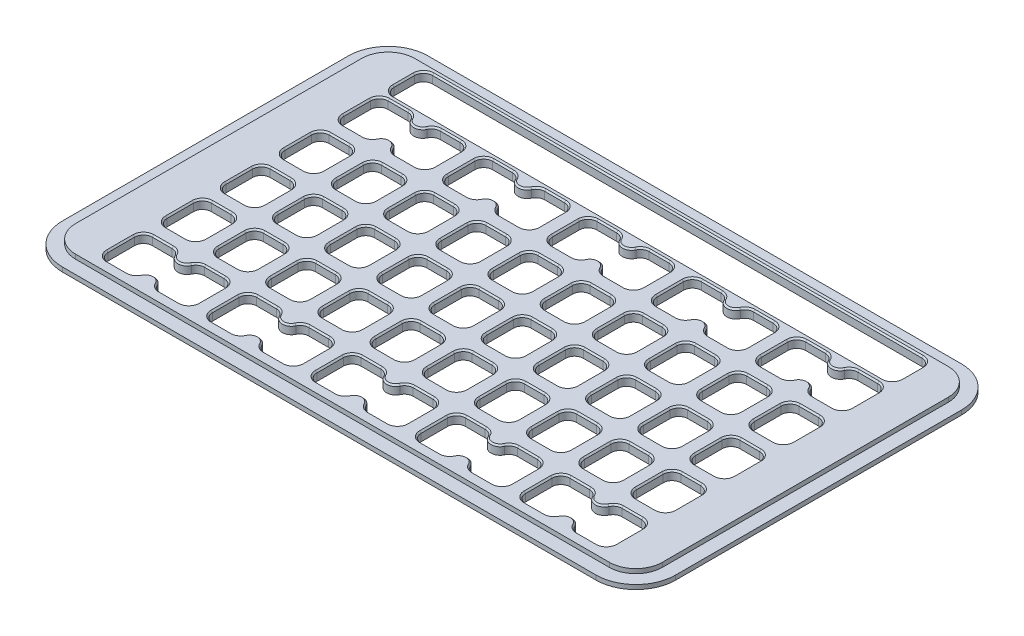
from build123d import *

# Parameters (mm, degrees)
SKETCH1_W                    = 208
SKETCH1_H                    = 124
OUTER_PROFILE_DEPTH          = 1.5
SKETCH2_W                    = 199
SKETCH2_H                    = 115
INNER_PROFILE_DEPTH          = 1.5
FILLET1_R                    = 9
FILLET2_R                    = 13.5
SKETCH4_W                    = 172
SKETCH4_H                    = 13
MESSAGE_BAR_DEPTH            = 122.115647214
CUTOUT_DEPTH                 = 122.115647214
CUTOUTS_COUNT                = 5
CUTOUTS_PITCH                = 17.7
CUTOUTS_COUNT_DIR2           = 5
CUTOUTS_PITCH_DIR2           = 20
MIRROR_CUTOUTS_COPY_1_DEPTH  = 122.115647214
MIRROR_CUTOUTS_COPY_2_DEPTH  = 122.115647214
MIRROR_CUTOUTS_COPY_3_DEPTH  = 122.115647214
MIRROR_CUTOUTS_COPY_4_DEPTH  = 122.115647214
MIRROR_CUTOUTS_COPY_5_DEPTH  = 122.115647214
MIRROR_CUTOUTS_COPY_6_DEPTH  = 122.115647214
MIRROR_CUTOUTS_COPY_7_DEPTH  = 122.115647214
MIRROR_CUTOUTS_COPY_8_DEPTH  = 122.115647214
MIRROR_CUTOUTS_COPY_9_DEPTH  = 122.115647214
MIRROR_CUTOUTS_COPY_10_DEPTH = 122.115647214
MIRROR_CUTOUTS_COPY_11_DEPTH = 122.115647214
MIRROR_CUTOUTS_COPY_12_DEPTH = 122.115647214
MIRROR_CUTOUTS_COPY_13_DEPTH = 122.115647214
MIRROR_CUTOUTS_COPY_14_DEPTH = 122.115647214
MIRROR_CUTOUTS_COPY_15_DEPTH = 122.115647214
MIRROR_CUTOUTS_COPY_16_DEPTH = 122.115647214
MIRROR_CUTOUTS_COPY_17_DEPTH = 122.115647214
MIRROR_CUTOUTS_COPY_18_DEPTH = 122.115647214
MIRROR_CUTOUTS_COPY_19_DEPTH = 122.115647214
MIRROR_CUTOUTS_COPY_20_DEPTH = 122.115647214
MIRROR_CUTOUTS_COPY_21_DEPTH = 122.115647214
MIRROR_CUTOUTS_COPY_22_DEPTH = 122.115647214
MIRROR_CUTOUTS_COPY_23_DEPTH = 122.115647214
MIRROR_CUTOUTS_COPY_24_DEPTH = 122.115647214
CORNER_RAD_R                 = 3
OPENING_DEPTH                = 122.115647214
OPENINGS_COUNT               = 5
OPENINGS_PITCH               = 35.4
OPENINGS_COUNT_DIR2          = 2
OPENINGS_PITCH_DIR2          = 80
CHAMFER_2_SIZE               = 0.5


with BuildPart() as part:
    # Sketch1 → Outer Profile (new body)
    with BuildSketch(Plane(origin=(0, 0, 0), x_dir=(1, 0, 0), z_dir=(0, 1, 0))):
        Rectangle(SKETCH1_W, SKETCH1_H)
    extrude(amount=OUTER_PROFILE_DEPTH)

    # Sketch2 → Inner Profile (add)
    with BuildSketch(Plane(origin=(0, 1.5, 0), x_dir=(1, 0, 0), z_dir=(0, 1, 0))):
        Rectangle(SKETCH2_W, SKETCH2_H)
    extrude(amount=INNER_PROFILE_DEPTH)

    # Fillet1
    fillet1_edges = [part.edges().sort_by_distance(p)[0] for p in [
        (99.5, 2.25, 57.5),
        (99.5, 2.25, -57.5),
        (-99.5, 2.25, -57.5),
        (-99.5, 2.25, 57.5),
    ]]
    fillet(fillet1_edges, radius=FILLET1_R)

    # Fillet2
    fillet2_edges = [part.edges().sort_by_distance(p)[0] for p in [
        (104, 0.75, 62),
        (-104, 0.75, 62),
        (-104, 0.75, -62),
        (104, 0.75, -62),
    ]]
    fillet(fillet2_edges, radius=FILLET2_R)

    # Sketch4 → Message Bar (cut, through all)
    with BuildSketch(Plane(origin=(0, 3, 0), x_dir=(1, 0, 0), z_dir=(0, 1, 0))):
        with Locations((0, 49.5)):
            Rectangle(SKETCH4_W, SKETCH4_H)
    extrude(amount=-MESSAGE_BAR_DEPTH, mode=Mode.SUBTRACT)

    # Sketch5 → Cutout (cut, through all)
    with BuildSketch(Plane(origin=(0, 3, 0), x_dir=(1, 0, 0), z_dir=(0, 1, 0))):
        with BuildLine():
            Line((-12.2, -54), (-5.5, -54))
            ThreePointArc((-5.5, -54), (-3.378679656, -53.121320344), (-2.5, -51))
            Line((-2.5, -51), (-2.5, -42))
            ThreePointArc((-2.5, -42), (-3.378679656, -39.878679656), (-5.5, -39))
            Line((-5.5, -39), (-12.2, -39))
            ThreePointArc((-12.2, -39), (-14.321320344, -39.878679656), (-15.2, -42))
            Line((-15.2, -42), (-15.2, -51))
            ThreePointArc((-15.2, -51), (-14.321320344, -53.121320344), (-12.2, -54))
        make_face()
    cutout = extrude(amount=-CUTOUT_DEPTH, mode=Mode.SUBTRACT)

    # Cutouts: Cutout 5 × 5
    with Locations(*[(-i * CUTOUTS_PITCH, 0, -j * CUTOUTS_PITCH_DIR2) for i in range(CUTOUTS_COUNT) for j in range(CUTOUTS_COUNT_DIR2) if (i, j) != (0, 0)]):
        add(cutout, mode=Mode.SUBTRACT)

    # Mirror Cutouts: Cutout across plane
    add(cutout.mirror(Plane(origin=(0, 0, 0), x_dir=(0, 0, 1), z_dir=(1, 0, 0))), mode=Mode.SUBTRACT)

    # Mirror Cutouts copy 1 sketch → Mirror Cutouts copy 1 (cut, through all)
    with BuildSketch(Plane(origin=(0, 3, -20), x_dir=(-1, 0, 0), z_dir=(0, 1, 0))):
        with BuildLine():
            Line((-12.2, 54), (-5.5, 54))
            ThreePointArc((-5.5, 54), (-3.378679656, 53.121320344), (-2.5, 51))
            Line((-2.5, 51), (-2.5, 42))
            ThreePointArc((-2.5, 42), (-3.378679656, 39.878679656), (-5.5, 39))
            Line((-5.5, 39), (-12.2, 39))
            ThreePointArc((-12.2, 39), (-14.321320344, 39.878679656), (-15.2, 42))
            Line((-15.2, 42), (-15.2, 51))
            ThreePointArc((-15.2, 51), (-14.321320344, 53.121320344), (-12.2, 54))
        make_face()
    extrude(amount=-MIRROR_CUTOUTS_COPY_1_DEPTH, mode=Mode.SUBTRACT)

    # Mirror Cutouts copy 2 sketch → Mirror Cutouts copy 2 (cut, through all)
    with BuildSketch(Plane(origin=(0, 3, -40), x_dir=(-1, 0, 0), z_dir=(0, 1, 0))):
        with BuildLine():
            Line((-12.2, 54), (-5.5, 54))
            ThreePointArc((-5.5, 54), (-3.378679656, 53.121320344), (-2.5, 51))
            Line((-2.5, 51), (-2.5, 42))
            ThreePointArc((-2.5, 42), (-3.378679656, 39.878679656), (-5.5, 39))
            Line((-5.5, 39), (-12.2, 39))
            ThreePointArc((-12.2, 39), (-14.321320344, 39.878679656), (-15.2, 42))
            Line((-15.2, 42), (-15.2, 51))
            ThreePointArc((-15.2, 51), (-14.321320344, 53.121320344), (-12.2, 54))
        make_face()
    extrude(amount=-MIRROR_CUTOUTS_COPY_2_DEPTH, mode=Mode.SUBTRACT)

    # Mirror Cutouts copy 3 sketch → Mirror Cutouts copy 3 (cut, through all)
    with BuildSketch(Plane(origin=(0, 3, -60), x_dir=(-1, 0, 0), z_dir=(0, 1, 0))):
        with BuildLine():
            Line((-12.2, 54), (-5.5, 54))
            ThreePointArc((-5.5, 54), (-3.378679656, 53.121320344), (-2.5, 51))
            Line((-2.5, 51), (-2.5, 42))
            ThreePointArc((-2.5, 42), (-3.378679656, 39.878679656), (-5.5, 39))
            Line((-5.5, 39), (-12.2, 39))
            ThreePointArc((-12.2, 39), (-14.321320344, 39.878679656), (-15.2, 42))
            Line((-15.2, 42), (-15.2, 51))
            ThreePointArc((-15.2, 51), (-14.321320344, 53.121320344), (-12.2, 54))
        make_face()
    extrude(amount=-MIRROR_CUTOUTS_COPY_3_DEPTH, mode=Mode.SUBTRACT)

    # Mirror Cutouts copy 4 sketch → Mirror Cutouts copy 4 (cut, through all)
    with BuildSketch(Plane(origin=(0, 3, -80), x_dir=(-1, 0, 0), z_dir=(0, 1, 0))):
        with BuildLine():
            Line((-12.2, 54), (-5.5, 54))
            ThreePointArc((-5.5, 54), (-3.378679656, 53.121320344), (-2.5, 51))
            Line((-2.5, 51), (-2.5, 42))
            ThreePointArc((-2.5, 42), (-3.378679656, 39.878679656), (-5.5, 39))
            Line((-5.5, 39), (-12.2, 39))
            ThreePointArc((-12.2, 39), (-14.321320344, 39.878679656), (-15.2, 42))
            Line((-15.2, 42), (-15.2, 51))
            ThreePointArc((-15.2, 51), (-14.321320344, 53.121320344), (-12.2, 54))
        make_face()
    extrude(amount=-MIRROR_CUTOUTS_COPY_4_DEPTH, mode=Mode.SUBTRACT)

    # Mirror Cutouts copy 5 sketch → Mirror Cutouts copy 5 (cut, through all)
    with BuildSketch(Plane(origin=(17.7, 3, 0), x_dir=(-1, 0, 0), z_dir=(0, 1, 0))):
        with BuildLine():
            Line((-12.2, 54), (-5.5, 54))
            ThreePointArc((-5.5, 54), (-3.378679656, 53.121320344), (-2.5, 51))
            Line((-2.5, 51), (-2.5, 42))
            ThreePointArc((-2.5, 42), (-3.378679656, 39.878679656), (-5.5, 39))
            Line((-5.5, 39), (-12.2, 39))
            ThreePointArc((-12.2, 39), (-14.321320344, 39.878679656), (-15.2, 42))
            Line((-15.2, 42), (-15.2, 51))
            ThreePointArc((-15.2, 51), (-14.321320344, 53.121320344), (-12.2, 54))
        make_face()
    extrude(amount=-MIRROR_CUTOUTS_COPY_5_DEPTH, mode=Mode.SUBTRACT)

    # Mirror Cutouts copy 6 sketch → Mirror Cutouts copy 6 (cut, through all)
    with BuildSketch(Plane(origin=(17.7, 3, -20), x_dir=(-1, 0, 0), z_dir=(0, 1, 0))):
        with BuildLine():
            Line((-12.2, 54), (-5.5, 54))
            ThreePointArc((-5.5, 54), (-3.378679656, 53.121320344), (-2.5, 51))
            Line((-2.5, 51), (-2.5, 42))
            ThreePointArc((-2.5, 42), (-3.378679656, 39.878679656), (-5.5, 39))
            Line((-5.5, 39), (-12.2, 39))
            ThreePointArc((-12.2, 39), (-14.321320344, 39.878679656), (-15.2, 42))
            Line((-15.2, 42), (-15.2, 51))
            ThreePointArc((-15.2, 51), (-14.321320344, 53.121320344), (-12.2, 54))
        make_face()
    extrude(amount=-MIRROR_CUTOUTS_COPY_6_DEPTH, mode=Mode.SUBTRACT)

    # Mirror Cutouts copy 7 sketch → Mirror Cutouts copy 7 (cut, through all)
    with BuildSketch(Plane(origin=(17.7, 3, -40), x_dir=(-1, 0, 0), z_dir=(0, 1, 0))):
        with BuildLine():
            Line((-12.2, 54), (-5.5, 54))
            ThreePointArc((-5.5, 54), (-3.378679656, 53.121320344), (-2.5, 51))
            Line((-2.5, 51), (-2.5, 42))
            ThreePointArc((-2.5, 42), (-3.378679656, 39.878679656), (-5.5, 39))
            Line((-5.5, 39), (-12.2, 39))
            ThreePointArc((-12.2, 39), (-14.321320344, 39.878679656), (-15.2, 42))
            Line((-15.2, 42), (-15.2, 51))
            ThreePointArc((-15.2, 51), (-14.321320344, 53.121320344), (-12.2, 54))
        make_face()
    extrude(amount=-MIRROR_CUTOUTS_COPY_7_DEPTH, mode=Mode.SUBTRACT)

    # Mirror Cutouts copy 8 sketch → Mirror Cutouts copy 8 (cut, through all)
    with BuildSketch(Plane(origin=(17.7, 3, -60), x_dir=(-1, 0, 0), z_dir=(0, 1, 0))):
        with BuildLine():
            Line((-12.2, 54), (-5.5, 54))
            ThreePointArc((-5.5, 54), (-3.378679656, 53.121320344), (-2.5, 51))
            Line((-2.5, 51), (-2.5, 42))
            ThreePointArc((-2.5, 42), (-3.378679656, 39.878679656), (-5.5, 39))
            Line((-5.5, 39), (-12.2, 39))
            ThreePointArc((-12.2, 39), (-14.321320344, 39.878679656), (-15.2, 42))
            Line((-15.2, 42), (-15.2, 51))
            ThreePointArc((-15.2, 51), (-14.321320344, 53.121320344), (-12.2, 54))
        make_face()
    extrude(amount=-MIRROR_CUTOUTS_COPY_8_DEPTH, mode=Mode.SUBTRACT)

    # Mirror Cutouts copy 9 sketch → Mirror Cutouts copy 9 (cut, through all)
    with BuildSketch(Plane(origin=(17.7, 3, -80), x_dir=(-1, 0, 0), z_dir=(0, 1, 0))):
        with BuildLine():
            Line((-12.2, 54), (-5.5, 54))
            ThreePointArc((-5.5, 54), (-3.378679656, 53.121320344), (-2.5, 51))
            Line((-2.5, 51), (-2.5, 42))
            ThreePointArc((-2.5, 42), (-3.378679656, 39.878679656), (-5.5, 39))
            Line((-5.5, 39), (-12.2, 39))
            ThreePointArc((-12.2, 39), (-14.321320344, 39.878679656), (-15.2, 42))
            Line((-15.2, 42), (-15.2, 51))
            ThreePointArc((-15.2, 51), (-14.321320344, 53.121320344), (-12.2, 54))
        make_face()
    extrude(amount=-MIRROR_CUTOUTS_COPY_9_DEPTH, mode=Mode.SUBTRACT)

    # Mirror Cutouts copy 10 sketch → Mirror Cutouts copy 10 (cut, through all)
    with BuildSketch(Plane(origin=(35.4, 3, 0), x_dir=(-1, 0, 0), z_dir=(0, 1, 0))):
        with BuildLine():
            Line((-12.2, 54), (-5.5, 54))
            ThreePointArc((-5.5, 54), (-3.378679656, 53.121320344), (-2.5, 51))
            Line((-2.5, 51), (-2.5, 42))
            ThreePointArc((-2.5, 42), (-3.378679656, 39.878679656), (-5.5, 39))
            Line((-5.5, 39), (-12.2, 39))
            ThreePointArc((-12.2, 39), (-14.321320344, 39.878679656), (-15.2, 42))
            Line((-15.2, 42), (-15.2, 51))
            ThreePointArc((-15.2, 51), (-14.321320344, 53.121320344), (-12.2, 54))
        make_face()
    extrude(amount=-MIRROR_CUTOUTS_COPY_10_DEPTH, mode=Mode.SUBTRACT)

    # Mirror Cutouts copy 11 sketch → Mirror Cutouts copy 11 (cut, through all)
    with BuildSketch(Plane(origin=(35.4, 3, -20), x_dir=(-1, 0, 0), z_dir=(0, 1, 0))):
        with BuildLine():
            Line((-12.2, 54), (-5.5, 54))
            ThreePointArc((-5.5, 54), (-3.378679656, 53.121320344), (-2.5, 51))
            Line((-2.5, 51), (-2.5, 42))
            ThreePointArc((-2.5, 42), (-3.378679656, 39.878679656), (-5.5, 39))
            Line((-5.5, 39), (-12.2, 39))
            ThreePointArc((-12.2, 39), (-14.321320344, 39.878679656), (-15.2, 42))
            Line((-15.2, 42), (-15.2, 51))
            ThreePointArc((-15.2, 51), (-14.321320344, 53.121320344), (-12.2, 54))
        make_face()
    extrude(amount=-MIRROR_CUTOUTS_COPY_11_DEPTH, mode=Mode.SUBTRACT)

    # Mirror Cutouts copy 12 sketch → Mirror Cutouts copy 12 (cut, through all)
    with BuildSketch(Plane(origin=(35.4, 3, -40), x_dir=(-1, 0, 0), z_dir=(0, 1, 0))):
        with BuildLine():
            Line((-12.2, 54), (-5.5, 54))
            ThreePointArc((-5.5, 54), (-3.378679656, 53.121320344), (-2.5, 51))
            Line((-2.5, 51), (-2.5, 42))
            ThreePointArc((-2.5, 42), (-3.378679656, 39.878679656), (-5.5, 39))
            Line((-5.5, 39), (-12.2, 39))
            ThreePointArc((-12.2, 39), (-14.321320344, 39.878679656), (-15.2, 42))
            Line((-15.2, 42), (-15.2, 51))
            ThreePointArc((-15.2, 51), (-14.321320344, 53.121320344), (-12.2, 54))
        make_face()
    extrude(amount=-MIRROR_CUTOUTS_COPY_12_DEPTH, mode=Mode.SUBTRACT)

    # Mirror Cutouts copy 13 sketch → Mirror Cutouts copy 13 (cut, through all)
    with BuildSketch(Plane(origin=(35.4, 3, -60), x_dir=(-1, 0, 0), z_dir=(0, 1, 0))):
        with BuildLine():
            Line((-12.2, 54), (-5.5, 54))
            ThreePointArc((-5.5, 54), (-3.378679656, 53.121320344), (-2.5, 51))
            Line((-2.5, 51), (-2.5, 42))
            ThreePointArc((-2.5, 42), (-3.378679656, 39.878679656), (-5.5, 39))
            Line((-5.5, 39), (-12.2, 39))
            ThreePointArc((-12.2, 39), (-14.321320344, 39.878679656), (-15.2, 42))
            Line((-15.2, 42), (-15.2, 51))
            ThreePointArc((-15.2, 51), (-14.321320344, 53.121320344), (-12.2, 54))
        make_face()
    extrude(amount=-MIRROR_CUTOUTS_COPY_13_DEPTH, mode=Mode.SUBTRACT)

    # Mirror Cutouts copy 14 sketch → Mirror Cutouts copy 14 (cut, through all)
    with BuildSketch(Plane(origin=(35.4, 3, -80), x_dir=(-1, 0, 0), z_dir=(0, 1, 0))):
        with BuildLine():
            Line((-12.2, 54), (-5.5, 54))
            ThreePointArc((-5.5, 54), (-3.378679656, 53.121320344), (-2.5, 51))
            Line((-2.5, 51), (-2.5, 42))
            ThreePointArc((-2.5, 42), (-3.378679656, 39.878679656), (-5.5, 39))
            Line((-5.5, 39), (-12.2, 39))
            ThreePointArc((-12.2, 39), (-14.321320344, 39.878679656), (-15.2, 42))
            Line((-15.2, 42), (-15.2, 51))
            ThreePointArc((-15.2, 51), (-14.321320344, 53.121320344), (-12.2, 54))
        make_face()
    extrude(amount=-MIRROR_CUTOUTS_COPY_14_DEPTH, mode=Mode.SUBTRACT)

    # Mirror Cutouts copy 15 sketch → Mirror Cutouts copy 15 (cut, through all)
    with BuildSketch(Plane(origin=(53.1, 3, 0), x_dir=(-1, 0, 0), z_dir=(0, 1, 0))):
        with BuildLine():
            Line((-12.2, 54), (-5.5, 54))
            ThreePointArc((-5.5, 54), (-3.378679656, 53.121320344), (-2.5, 51))
            Line((-2.5, 51), (-2.5, 42))
            ThreePointArc((-2.5, 42), (-3.378679656, 39.878679656), (-5.5, 39))
            Line((-5.5, 39), (-12.2, 39))
            ThreePointArc((-12.2, 39), (-14.321320344, 39.878679656), (-15.2, 42))
            Line((-15.2, 42), (-15.2, 51))
            ThreePointArc((-15.2, 51), (-14.321320344, 53.121320344), (-12.2, 54))
        make_face()
    extrude(amount=-MIRROR_CUTOUTS_COPY_15_DEPTH, mode=Mode.SUBTRACT)

    # Mirror Cutouts copy 16 sketch → Mirror Cutouts copy 16 (cut, through all)
    with BuildSketch(Plane(origin=(53.1, 3, -20), x_dir=(-1, 0, 0), z_dir=(0, 1, 0))):
        with BuildLine():
            Line((-12.2, 54), (-5.5, 54))
            ThreePointArc((-5.5, 54), (-3.378679656, 53.121320344), (-2.5, 51))
            Line((-2.5, 51), (-2.5, 42))
            ThreePointArc((-2.5, 42), (-3.378679656, 39.878679656), (-5.5, 39))
            Line((-5.5, 39), (-12.2, 39))
            ThreePointArc((-12.2, 39), (-14.321320344, 39.878679656), (-15.2, 42))
            Line((-15.2, 42), (-15.2, 51))
            ThreePointArc((-15.2, 51), (-14.321320344, 53.121320344), (-12.2, 54))
        make_face()
    extrude(amount=-MIRROR_CUTOUTS_COPY_16_DEPTH, mode=Mode.SUBTRACT)

    # Mirror Cutouts copy 17 sketch → Mirror Cutouts copy 17 (cut, through all)
    with BuildSketch(Plane(origin=(53.1, 3, -40), x_dir=(-1, 0, 0), z_dir=(0, 1, 0))):
        with BuildLine():
            Line((-12.2, 54), (-5.5, 54))
            ThreePointArc((-5.5, 54), (-3.378679656, 53.121320344), (-2.5, 51))
            Line((-2.5, 51), (-2.5, 42))
            ThreePointArc((-2.5, 42), (-3.378679656, 39.878679656), (-5.5, 39))
            Line((-5.5, 39), (-12.2, 39))
            ThreePointArc((-12.2, 39), (-14.321320344, 39.878679656), (-15.2, 42))
            Line((-15.2, 42), (-15.2, 51))
            ThreePointArc((-15.2, 51), (-14.321320344, 53.121320344), (-12.2, 54))
        make_face()
    extrude(amount=-MIRROR_CUTOUTS_COPY_17_DEPTH, mode=Mode.SUBTRACT)

    # Mirror Cutouts copy 18 sketch → Mirror Cutouts copy 18 (cut, through all)
    with BuildSketch(Plane(origin=(53.1, 3, -60), x_dir=(-1, 0, 0), z_dir=(0, 1, 0))):
        with BuildLine():
            Line((-12.2, 54), (-5.5, 54))
            ThreePointArc((-5.5, 54), (-3.378679656, 53.121320344), (-2.5, 51))
            Line((-2.5, 51), (-2.5, 42))
            ThreePointArc((-2.5, 42), (-3.378679656, 39.878679656), (-5.5, 39))
            Line((-5.5, 39), (-12.2, 39))
            ThreePointArc((-12.2, 39), (-14.321320344, 39.878679656), (-15.2, 42))
            Line((-15.2, 42), (-15.2, 51))
            ThreePointArc((-15.2, 51), (-14.321320344, 53.121320344), (-12.2, 54))
        make_face()
    extrude(amount=-MIRROR_CUTOUTS_COPY_18_DEPTH, mode=Mode.SUBTRACT)

    # Mirror Cutouts copy 19 sketch → Mirror Cutouts copy 19 (cut, through all)
    with BuildSketch(Plane(origin=(53.1, 3, -80), x_dir=(-1, 0, 0), z_dir=(0, 1, 0))):
        with BuildLine():
            Line((-12.2, 54), (-5.5, 54))
            ThreePointArc((-5.5, 54), (-3.378679656, 53.121320344), (-2.5, 51))
            Line((-2.5, 51), (-2.5, 42))
            ThreePointArc((-2.5, 42), (-3.378679656, 39.878679656), (-5.5, 39))
            Line((-5.5, 39), (-12.2, 39))
            ThreePointArc((-12.2, 39), (-14.321320344, 39.878679656), (-15.2, 42))
            Line((-15.2, 42), (-15.2, 51))
            ThreePointArc((-15.2, 51), (-14.321320344, 53.121320344), (-12.2, 54))
        make_face()
    extrude(amount=-MIRROR_CUTOUTS_COPY_19_DEPTH, mode=Mode.SUBTRACT)

    # Mirror Cutouts copy 20 sketch → Mirror Cutouts copy 20 (cut, through all)
    with BuildSketch(Plane(origin=(70.8, 3, 0), x_dir=(-1, 0, 0), z_dir=(0, 1, 0))):
        with BuildLine():
            Line((-12.2, 54), (-5.5, 54))
            ThreePointArc((-5.5, 54), (-3.378679656, 53.121320344), (-2.5, 51))
            Line((-2.5, 51), (-2.5, 42))
            ThreePointArc((-2.5, 42), (-3.378679656, 39.878679656), (-5.5, 39))
            Line((-5.5, 39), (-12.2, 39))
            ThreePointArc((-12.2, 39), (-14.321320344, 39.878679656), (-15.2, 42))
            Line((-15.2, 42), (-15.2, 51))
            ThreePointArc((-15.2, 51), (-14.321320344, 53.121320344), (-12.2, 54))
        make_face()
    extrude(amount=-MIRROR_CUTOUTS_COPY_20_DEPTH, mode=Mode.SUBTRACT)

    # Mirror Cutouts copy 21 sketch → Mirror Cutouts copy 21 (cut, through all)
    with BuildSketch(Plane(origin=(70.8, 3, -20), x_dir=(-1, 0, 0), z_dir=(0, 1, 0))):
        with BuildLine():
            Line((-12.2, 54), (-5.5, 54))
            ThreePointArc((-5.5, 54), (-3.378679656, 53.121320344), (-2.5, 51))
            Line((-2.5, 51), (-2.5, 42))
            ThreePointArc((-2.5, 42), (-3.378679656, 39.878679656), (-5.5, 39))
            Line((-5.5, 39), (-12.2, 39))
            ThreePointArc((-12.2, 39), (-14.321320344, 39.878679656), (-15.2, 42))
            Line((-15.2, 42), (-15.2, 51))
            ThreePointArc((-15.2, 51), (-14.321320344, 53.121320344), (-12.2, 54))
        make_face()
    extrude(amount=-MIRROR_CUTOUTS_COPY_21_DEPTH, mode=Mode.SUBTRACT)

    # Mirror Cutouts copy 22 sketch → Mirror Cutouts copy 22 (cut, through all)
    with BuildSketch(Plane(origin=(70.8, 3, -40), x_dir=(-1, 0, 0), z_dir=(0, 1, 0))):
        with BuildLine():
            Line((-12.2, 54), (-5.5, 54))
            ThreePointArc((-5.5, 54), (-3.378679656, 53.121320344), (-2.5, 51))
            Line((-2.5, 51), (-2.5, 42))
            ThreePointArc((-2.5, 42), (-3.378679656, 39.878679656), (-5.5, 39))
            Line((-5.5, 39), (-12.2, 39))
            ThreePointArc((-12.2, 39), (-14.321320344, 39.878679656), (-15.2, 42))
            Line((-15.2, 42), (-15.2, 51))
            ThreePointArc((-15.2, 51), (-14.321320344, 53.121320344), (-12.2, 54))
        make_face()
    extrude(amount=-MIRROR_CUTOUTS_COPY_22_DEPTH, mode=Mode.SUBTRACT)

    # Mirror Cutouts copy 23 sketch → Mirror Cutouts copy 23 (cut, through all)
    with BuildSketch(Plane(origin=(70.8, 3, -60), x_dir=(-1, 0, 0), z_dir=(0, 1, 0))):
        with BuildLine():
            Line((-12.2, 54), (-5.5, 54))
            ThreePointArc((-5.5, 54), (-3.378679656, 53.121320344), (-2.5, 51))
            Line((-2.5, 51), (-2.5, 42))
            ThreePointArc((-2.5, 42), (-3.378679656, 39.878679656), (-5.5, 39))
            Line((-5.5, 39), (-12.2, 39))
            ThreePointArc((-12.2, 39), (-14.321320344, 39.878679656), (-15.2, 42))
            Line((-15.2, 42), (-15.2, 51))
            ThreePointArc((-15.2, 51), (-14.321320344, 53.121320344), (-12.2, 54))
        make_face()
    extrude(amount=-MIRROR_CUTOUTS_COPY_23_DEPTH, mode=Mode.SUBTRACT)

    # Mirror Cutouts copy 24 sketch → Mirror Cutouts copy 24 (cut, through all)
    with BuildSketch(Plane(origin=(70.8, 3, -80), x_dir=(-1, 0, 0), z_dir=(0, 1, 0))):
        with BuildLine():
            Line((-12.2, 54), (-5.5, 54))
            ThreePointArc((-5.5, 54), (-3.378679656, 53.121320344), (-2.5, 51))
            Line((-2.5, 51), (-2.5, 42))
            ThreePointArc((-2.5, 42), (-3.378679656, 39.878679656), (-5.5, 39))
            Line((-5.5, 39), (-12.2, 39))
            ThreePointArc((-12.2, 39), (-14.321320344, 39.878679656), (-15.2, 42))
            Line((-15.2, 42), (-15.2, 51))
            ThreePointArc((-15.2, 51), (-14.321320344, 53.121320344), (-12.2, 54))
        make_face()
    extrude(amount=-MIRROR_CUTOUTS_COPY_24_DEPTH, mode=Mode.SUBTRACT)

    # Corner Rad
    corner_rad_edges = [part.edges().sort_by_distance(p)[0] for p in [
        (-86, 1.5, -43),
        (-86, 1.5, -56),
        (86, 1.5, -56),
        (86, 1.5, -43),
    ]]
    fillet(corner_rad_edges, radius=CORNER_RAD_R)

    # Sketch6 → Opening (cut, through all)
    with BuildSketch(Plane(origin=(0, 3, 0), x_dir=(1, 0, 0), z_dir=(0, 1, 0))):
        with BuildLine():
            Line((-68.3, 38), (-68.3, 29))
            ThreePointArc((-68.3, 29), (-68.228561181, 28.349208627), (-68.017647059, 27.729411765))
            ThreePointArc((-68.017647059, 27.729411765), (-70.8, 29.5), (-73.582352941, 27.729411765))
            ThreePointArc((-73.582352941, 27.729411765), (-73.371438819, 28.349208627), (-73.3, 29))
            Line((-73.3, 29), (-73.3, 38))
            ThreePointArc((-73.3, 38), (-73.371438819, 38.650791373), (-73.582352941, 39.270588235))
            ThreePointArc((-73.582352941, 39.270588235), (-70.8, 37.5), (-68.017647059, 39.270588235))
            ThreePointArc((-68.017647059, 39.270588235), (-68.228561181, 38.650791373), (-68.3, 38))
        make_face()
    opening = extrude(amount=-OPENING_DEPTH, mode=Mode.SUBTRACT)

    # Openings: Opening 5 × 2
    with Locations(*[(i * OPENINGS_PITCH, 0, j * OPENINGS_PITCH_DIR2) for i in range(OPENINGS_COUNT) for j in range(OPENINGS_COUNT_DIR2) if (i, j) != (0, 0)]):
        add(opening, mode=Mode.SUBTRACT)

    # Chamfer 2
    chamfer_2_edges = [part.edges().sort_by_distance(p)[0] for p in [
        (38.778679656, 3, 33.121320344),
        (37.9, 3, 26.5),
        (38.778679656, 3, 19.878679656),
        (44.25, 3, 19),
        (49.721320344, 3, 19.878679656),
        (50.6, 3, 26.5),
        (49.721320344, 3, 33.121320344),
        (44.25, 3, 34),
        (38.778679656, 3, 13.121320344),
        (37.9, 3, 6.5),
        (38.778679656, 3, -0.121320344),
        (44.25, 3, -1),
        (49.721320344, 3, -0.121320344),
        (50.6, 3, 6.5),
        (49.721320344, 3, 13.121320344),
        (44.25, 3, 14),
        (-3.889373523, 3, 53.530984463),
        (38.778679656, 3, -6.878679656),
        (37.9, 3, -13.5),
        (38.778679656, 3, -20.121320344),
        (44.25, 3, -21),
        (49.721320344, 3, -20.121320344),
        (50.6, 3, -13.5),
        (49.721320344, 3, -6.878679656),
        (44.25, 3, -6),
        (-8.85, 3, 39),
        (-14.321320344, 3, 39.878679656),
        (-15.2, 3, 46.5),
        (-14.321320344, 3, 53.121320344),
        (-8.85, 3, 54),
        (39.289373523, 3, -26.469015537),
        (44.25, 3, -41),
        (49.721320344, 3, -40.121320344),
        (50.6, 3, -33.5),
        (49.721320344, 3, -26.878679656),
        (44.25, 3, -26),
        (56.478679656, 3, 53.121320344),
        (55.6, 3, 46.5),
        (56.478679656, 3, 39.878679656),
        (61.95, 3, 39),
        (66.910626477, 3, 39.469015537),
        (61.95, 3, 54),
        (56.478679656, 3, 33.121320344),
        (55.6, 3, 26.5),
        (56.478679656, 3, 19.878679656),
        (61.95, 3, 19),
        (67.421320344, 3, 19.878679656),
        (68.3, 3, 26.5),
        (67.421320344, 3, 33.121320344),
        (61.95, 3, 34),
        (56.478679656, 3, 13.121320344),
        (55.6, 3, 6.5),
        (56.478679656, 3, -0.121320344),
        (61.95, 3, -1),
        (67.421320344, 3, -0.121320344),
        (68.3, 3, 6.5),
        (67.421320344, 3, 13.121320344),
        (61.95, 3, 14),
        (56.478679656, 3, -6.878679656),
        (55.6, 3, -13.5),
        (56.478679656, 3, -20.121320344),
        (61.95, 3, -21),
        (67.421320344, 3, -20.121320344),
        (68.3, 3, -13.5),
        (67.421320344, 3, -6.878679656),
        (61.95, 3, -6),
        (56.478679656, 3, -26.878679656),
        (55.6, 3, -33.5),
        (56.478679656, 3, -40.121320344),
        (61.95, 3, -41),
        (66.910626477, 3, -40.530984463),
        (61.95, 3, -26),
        (74.689373523, 3, 53.530984463),
        (79.65, 3, 39),
        (85.121320344, 3, 39.878679656),
        (86, 3, 46.5),
        (85.121320344, 3, 53.121320344),
        (79.65, 3, 54),
        (74.178679656, 3, 33.121320344),
        (73.3, 3, 26.5),
        (74.178679656, 3, 19.878679656),
        (79.65, 3, 19),
        (85.121320344, 3, 19.878679656),
        (86, 3, 26.5),
        (85.121320344, 3, 33.121320344),
        (79.65, 3, 34),
        (74.178679656, 3, 13.121320344),
        (73.3, 3, 6.5),
        (74.178679656, 3, -0.121320344),
        (79.65, 3, -1),
        (85.121320344, 3, -0.121320344),
        (86, 3, 6.5),
        (85.121320344, 3, 13.121320344),
        (79.65, 3, 14),
        (74.178679656, 3, -6.878679656),
        (73.3, 3, -13.5),
        (74.178679656, 3, -20.121320344),
        (79.65, 3, -21),
        (85.121320344, 3, -20.121320344),
        (86, 3, -13.5),
        (85.121320344, 3, -6.878679656),
        (79.65, 3, -6),
        (74.689373523, 3, -26.469015537),
        (79.65, 3, -41),
        (85.121320344, 3, -40.121320344),
        (86, 3, -33.5),
        (85.121320344, 3, -26.878679656),
        (79.65, 3, -26),
        (-3.378679656, 3, 33.121320344),
        (-2.5, 3, 26.5),
        (-3.378679656, 3, 19.878679656),
        (-8.85, 3, 19),
        (-14.321320344, 3, 19.878679656),
        (-15.2, 3, 26.5),
        (-14.321320344, 3, 33.121320344),
        (-8.85, 3, 34),
        (86, 3, -49.5),
        (0, 3, -43),
        (0, 3, -56),
        (-86, 3, -49.5),
        (85.121320344, 3, -43.878679656),
        (85.121320344, 3, -55.121320344),
        (-85.121320344, 3, -43.878679656),
        (-85.121320344, 3, -55.121320344),
        (-74.689373523, 3, -40.530984463),
        (-66.910626477, 3, -26.469015537),
        (-70.8, 3, -29.5),
        (-70.8, 3, -37.5),
        (-74.689373523, 3, 39.469015537),
        (-66.910626477, 3, 53.530984463),
        (-70.8, 3, 50.5),
        (-70.8, 3, 42.5),
        (-39.289373523, 3, -40.530984463),
        (-31.510626477, 3, -26.469015537),
        (-35.4, 3, -29.5),
        (-35.4, 3, -37.5),
        (-39.289373523, 3, 39.469015537),
        (-31.510626477, 3, 53.530984463),
        (-35.4, 3, 50.5),
        (-35.4, 3, 42.5),
        (3.889373523, 3, -40.530984463),
        (-3.889373523, 3, -40.530984463),
        (0, 3, -29.5),
        (0, 3, -37.5),
        (3.889373523, 3, 39.469015537),
        (-3.889373523, 3, 39.469015537),
        (0, 3, 50.5),
        (0, 3, 42.5),
        (39.289373523, 3, -40.530984463),
        (31.510626477, 3, -26.469015537),
        (35.4, 3, -29.5),
        (35.4, 3, -37.5),
        (39.289373523, 3, 39.469015537),
        (-3.378679656, 3, 13.121320344),
        (31.510626477, 3, 53.530984463),
        (-2.5, 3, 6.5),
        (-3.378679656, 3, -0.121320344),
        (35.4, 3, 50.5),
        (-8.85, 3, -1),
        (35.4, 3, 42.5),
        (-14.321320344, 3, -0.121320344),
        (-15.2, 3, 6.5),
        (-14.321320344, 3, 13.121320344),
        (-8.85, 3, 14),
        (74.689373523, 3, -40.530984463),
        (66.910626477, 3, -26.469015537),
        (70.8, 3, -29.5),
        (70.8, 3, -37.5),
        (74.689373523, 3, 39.469015537),
        (66.910626477, 3, 53.530984463),
        (70.8, 3, 50.5),
        (70.8, 3, 42.5),
        (-3.378679656, 3, -6.878679656),
        (-2.5, 3, -13.5),
        (-3.378679656, 3, -20.121320344),
        (-8.85, 3, -21),
        (-14.321320344, 3, -20.121320344),
        (-15.2, 3, -13.5),
        (-14.321320344, 3, -6.878679656),
        (-8.85, 3, -6),
        (-3.889373523, 3, -26.469015537),
        (-8.85, 3, -41),
        (-14.321320344, 3, -40.121320344),
        (-15.2, 3, -33.5),
        (-14.321320344, 3, -26.878679656),
        (-8.85, 3, -26),
        (-21.078679656, 3, 53.121320344),
        (-20.2, 3, 46.5),
        (-21.078679656, 3, 39.878679656),
        (-26.55, 3, 39),
        (-31.510626477, 3, 39.469015537),
        (-26.55, 3, 54),
        (-21.078679656, 3, 33.121320344),
        (-20.2, 3, 26.5),
        (-21.078679656, 3, 19.878679656),
        (-26.55, 3, 19),
        (-32.021320344, 3, 19.878679656),
        (-32.9, 3, 26.5),
        (-32.021320344, 3, 33.121320344),
        (-26.55, 3, 34),
        (-21.078679656, 3, 13.121320344),
        (-20.2, 3, 6.5),
        (-21.078679656, 3, -0.121320344),
        (-26.55, 3, -1),
        (-32.021320344, 3, -0.121320344),
        (-32.9, 3, 6.5),
        (-32.021320344, 3, 13.121320344),
        (-26.55, 3, 14),
        (-21.078679656, 3, -6.878679656),
        (-20.2, 3, -13.5),
        (-21.078679656, 3, -20.121320344),
        (-26.55, 3, -21),
        (-32.021320344, 3, -20.121320344),
        (-32.9, 3, -13.5),
        (-32.021320344, 3, -6.878679656),
        (-26.55, 3, -6),
        (-21.078679656, 3, -26.878679656),
        (-20.2, 3, -33.5),
        (-21.078679656, 3, -40.121320344),
        (-26.55, 3, -41),
        (-31.510626477, 3, -40.530984463),
        (-26.55, 3, -26),
        (-39.289373523, 3, 53.530984463),
        (-44.25, 3, 39),
        (-49.721320344, 3, 39.878679656),
        (-50.6, 3, 46.5),
        (-49.721320344, 3, 53.121320344),
        (-44.25, 3, 54),
        (-38.778679656, 3, 33.121320344),
        (-37.9, 3, 26.5),
        (-38.778679656, 3, 19.878679656),
        (-44.25, 3, 19),
        (-49.721320344, 3, 19.878679656),
        (-50.6, 3, 26.5),
        (-49.721320344, 3, 33.121320344),
        (-44.25, 3, 34),
        (-38.778679656, 3, 13.121320344),
        (-37.9, 3, 6.5),
        (-38.778679656, 3, -0.121320344),
        (-44.25, 3, -1),
        (-49.721320344, 3, -0.121320344),
        (-50.6, 3, 6.5),
        (-49.721320344, 3, 13.121320344),
        (-44.25, 3, 14),
        (-38.778679656, 3, -6.878679656),
        (-37.9, 3, -13.5),
        (-38.778679656, 3, -20.121320344),
        (-44.25, 3, -21),
        (-49.721320344, 3, -20.121320344),
        (-50.6, 3, -13.5),
        (-49.721320344, 3, -6.878679656),
        (-44.25, 3, -6),
        (-39.289373523, 3, -26.469015537),
        (-44.25, 3, -41),
        (-49.721320344, 3, -40.121320344),
        (-50.6, 3, -33.5),
        (-49.721320344, 3, -26.878679656),
        (-44.25, 3, -26),
        (-56.478679656, 3, 53.121320344),
        (-55.6, 3, 46.5),
        (-56.478679656, 3, 39.878679656),
        (-61.95, 3, 39),
        (-66.910626477, 3, 39.469015537),
        (-61.95, 3, 54),
        (-56.478679656, 3, 33.121320344),
        (-55.6, 3, 26.5),
        (-56.478679656, 3, 19.878679656),
        (-61.95, 3, 19),
        (-67.421320344, 3, 19.878679656),
        (-68.3, 3, 26.5),
        (-67.421320344, 3, 33.121320344),
        (-61.95, 3, 34),
        (-56.478679656, 3, 13.121320344),
        (-55.6, 3, 6.5),
        (-56.478679656, 3, -0.121320344),
        (-61.95, 3, -1),
        (-67.421320344, 3, -0.121320344),
        (-68.3, 3, 6.5),
        (-67.421320344, 3, 13.121320344),
        (-61.95, 3, 14),
        (-56.478679656, 3, -6.878679656),
        (-55.6, 3, -13.5),
        (-56.478679656, 3, -20.121320344),
        (-61.95, 3, -21),
        (-67.421320344, 3, -20.121320344),
        (-68.3, 3, -13.5),
        (-67.421320344, 3, -6.878679656),
        (-61.95, 3, -6),
        (-56.478679656, 3, -26.878679656),
        (-55.6, 3, -33.5),
        (-56.478679656, 3, -40.121320344),
        (-61.95, 3, -41),
        (-66.910626477, 3, -40.530984463),
        (-61.95, 3, -26),
        (-74.689373523, 3, 53.530984463),
        (-79.65, 3, 39),
        (-85.121320344, 3, 39.878679656),
        (-86, 3, 46.5),
        (-85.121320344, 3, 53.121320344),
        (-79.65, 3, 54),
        (-74.178679656, 3, 33.121320344),
        (-73.3, 3, 26.5),
        (-74.178679656, 3, 19.878679656),
        (-79.65, 3, 19),
        (-85.121320344, 3, 19.878679656),
        (-86, 3, 26.5),
        (-85.121320344, 3, 33.121320344),
        (-79.65, 3, 34),
        (-74.178679656, 3, 13.121320344),
        (-73.3, 3, 6.5),
        (-74.178679656, 3, -0.121320344),
        (-79.65, 3, -1),
        (-85.121320344, 3, -0.121320344),
        (-86, 3, 6.5),
        (-85.121320344, 3, 13.121320344),
        (-79.65, 3, 14),
        (-74.178679656, 3, -6.878679656),
        (-73.3, 3, -13.5),
        (-74.178679656, 3, -20.121320344),
        (-79.65, 3, -21),
        (-85.121320344, 3, -20.121320344),
        (-86, 3, -13.5),
        (-85.121320344, 3, -6.878679656),
        (-79.65, 3, -6),
        (-74.689373523, 3, -26.469015537),
        (-79.65, 3, -41),
        (-85.121320344, 3, -40.121320344),
        (-86, 3, -33.5),
        (-85.121320344, 3, -26.878679656),
        (-79.65, 3, -26),
        (3.889373523, 3, 53.530984463),
        (8.85, 3, 39),
        (14.321320344, 3, 39.878679656),
        (15.2, 3, 46.5),
        (14.321320344, 3, 53.121320344),
        (8.85, 3, 54),
        (3.378679656, 3, 33.121320344),
        (2.5, 3, 26.5),
        (3.378679656, 3, 19.878679656),
        (8.85, 3, 19),
        (14.321320344, 3, 19.878679656),
        (15.2, 3, 26.5),
        (14.321320344, 3, 33.121320344),
        (8.85, 3, 34),
        (3.378679656, 3, 13.121320344),
        (2.5, 3, 6.5),
        (3.378679656, 3, -0.121320344),
        (8.85, 3, -1),
        (14.321320344, 3, -0.121320344),
        (15.2, 3, 6.5),
        (14.321320344, 3, 13.121320344),
        (8.85, 3, 14),
        (3.378679656, 3, -6.878679656),
        (2.5, 3, -13.5),
        (3.378679656, 3, -20.121320344),
        (8.85, 3, -21),
        (14.321320344, 3, -20.121320344),
        (15.2, 3, -13.5),
        (14.321320344, 3, -6.878679656),
        (8.85, 3, -6),
        (3.889373523, 3, -26.469015537),
        (8.85, 3, -41),
        (14.321320344, 3, -40.121320344),
        (15.2, 3, -33.5),
        (14.321320344, 3, -26.878679656),
        (8.85, 3, -26),
        (21.078679656, 3, 53.121320344),
        (20.2, 3, 46.5),
        (21.078679656, 3, 39.878679656),
        (26.55, 3, 39),
        (31.510626477, 3, 39.469015537),
        (26.55, 3, 54),
        (21.078679656, 3, 33.121320344),
        (20.2, 3, 26.5),
        (21.078679656, 3, 19.878679656),
        (26.55, 3, 19),
        (32.021320344, 3, 19.878679656),
        (32.9, 3, 26.5),
        (32.021320344, 3, 33.121320344),
        (26.55, 3, 34),
        (21.078679656, 3, 13.121320344),
        (20.2, 3, 6.5),
        (21.078679656, 3, -0.121320344),
        (26.55, 3, -1),
        (32.021320344, 3, -0.121320344),
        (32.9, 3, 6.5),
        (32.021320344, 3, 13.121320344),
        (26.55, 3, 14),
        (21.078679656, 3, -6.878679656),
        (20.2, 3, -13.5),
        (21.078679656, 3, -20.121320344),
        (26.55, 3, -21),
        (32.021320344, 3, -20.121320344),
        (32.9, 3, -13.5),
        (32.021320344, 3, -6.878679656),
        (26.55, 3, -6),
        (21.078679656, 3, -26.878679656),
        (20.2, 3, -33.5),
        (21.078679656, 3, -40.121320344),
        (26.55, 3, -41),
    ]]
    chamfer(chamfer_2_edges, length=CHAMFER_2_SIZE)


solid = part.part
